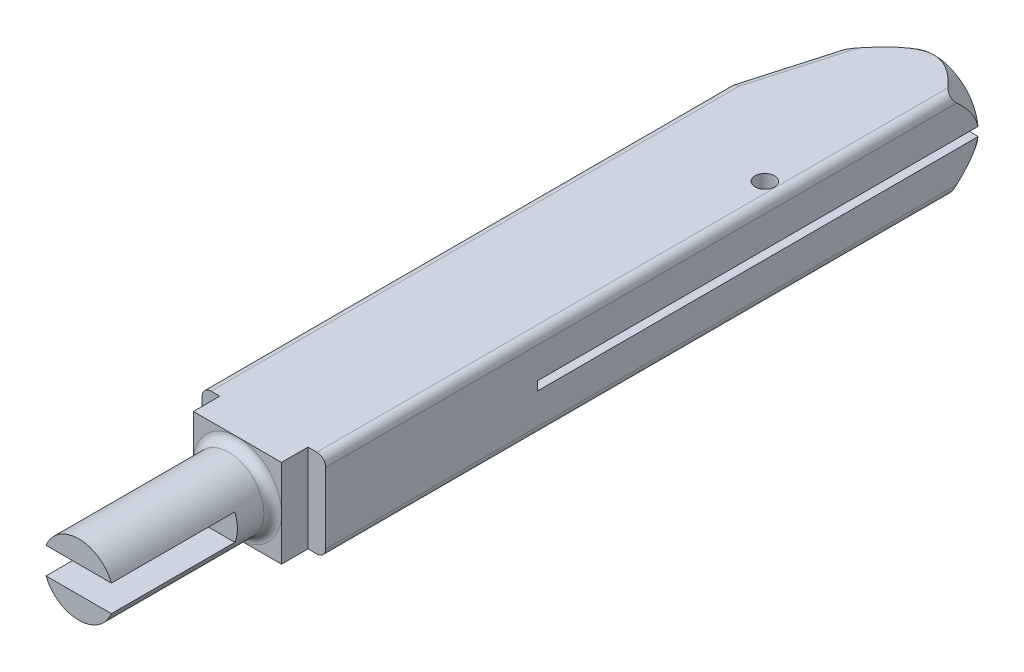
from build123d import *

# Parameters (mm, degrees)
SKETCH_1_W          = 7
SKETCH_1_H          = 5
EXTRUDE_1_DEPTH     = 37
SKETCH_2_W          = 5
SKETCH_2_H          = 5
EXTRUDE_2_DEPTH     = 1.5
SKETCH_3_R          = 2
EXTRUDE_3_DEPTH     = 9
SKETCH_4_W          = 14.679104028
SKETCH_4_H          = 1.5
CUT_EXTRUDE_1_DEPTH = 7
CUT_EXTRUDE_2_DEPTH = 48.890500102
SKETCH_6_W          = 13.59673758
SKETCH_6_H          = 0.5
CUT_EXTRUDE_3_DEPTH = 25
SKETCH_7_OUTSIDE_W  = 24.428
SKETCH_7_OUTSIDE_H  = 22.428
SKETCH_7_OUTSIDE_R  = 2.5
CUT_EXTRUDE_7_DEPTH = 5
CUT_EXTRUDE_7_DRAFT = -30
SKETCH_8_R          = 1
CUT_EXTRUDE_8_DEPTH = 15
FILLET_1_R          = 0.5
FILLET_2_R          = 0.5
SKETCH_9_R          = 0.55
CUT_EXTRUDE_9_DEPTH = 48.89050012
CHAMFER_1_SIZE      = 0.5


# Some blends are built 0.0001 mm under size
with BuildPart() as part:
    # 草图1 → 凸台-拉伸1 (new body)
    with BuildSketch(Plane.XY):
        Rectangle(SKETCH_1_W, SKETCH_1_H)
    extrude(amount=EXTRUDE_1_DEPTH)

    # 草图2 → 凸台-拉伸2 (add)
    with BuildSketch(Plane.XY.offset(37)):
        Rectangle(SKETCH_2_W, SKETCH_2_H)
    extrude(amount=EXTRUDE_2_DEPTH)

    # 草图3 → 凸台-拉伸3 (add)
    with BuildSketch(Plane.XY.offset(38.5)):
        Circle(SKETCH_3_R)
    extrude(amount=EXTRUDE_3_DEPTH)

    # 草图4 → 切除-拉伸1 (cut)
    with BuildSketch(Plane.XY.offset(47.5)):
        Rectangle(SKETCH_4_W, SKETCH_4_H)
    extrude(amount=-CUT_EXTRUDE_1_DEPTH, mode=Mode.SUBTRACT)

    # 草图5 → 切除-拉伸2 (cut, through all)
    with BuildSketch(Plane(origin=(0, 2.5, 0), x_dir=(1, 0, 0), z_dir=(0, 1, 0))):
        Polygon((-3.5, 0), (-3.5, -7), (-1.5, 0), align=None)
    extrude(amount=-CUT_EXTRUDE_2_DEPTH, mode=Mode.SUBTRACT)

    # 草图6 → 切除-拉伸3 (cut)
    with BuildSketch(Plane(origin=(0, 0, 0), x_dir=(-1, 0, 0), z_dir=(0, 0, -1))):
        Rectangle(SKETCH_6_W, SKETCH_6_H)
    extrude(amount=-CUT_EXTRUDE_3_DEPTH, mode=Mode.SUBTRACT)


with BuildPart() as cut_extrude_7_tool:
    # 草图7 outside → 切除-拉伸7 (with draft: the straight prism first)
    with BuildSketch(Plane(origin=(0, 0, 0), x_dir=(-1, 0, 0), z_dir=(0, 0, -1))):
        Rectangle(SKETCH_7_OUTSIDE_W, SKETCH_7_OUTSIDE_H)
        with Locations((-1, 0)):
            Circle(SKETCH_7_OUTSIDE_R, mode=Mode.SUBTRACT)
    extrude(amount=-CUT_EXTRUDE_7_DEPTH)
    # 切除-拉伸7: the draft: its side faces are tilted about the plane it starts from
    cut_extrude_7_sides = [cut_extrude_7_tool.faces().sort_by_distance(p)[0] for p in [
        (0, -11.214, 2.5),
        (-12.214, 0, 2.5),
        (0, 11.214, 2.5),
        (12.214, 0, 2.5),
        (3.5, 0, 2.5),
    ]]
    draft(cut_extrude_7_sides, Plane(origin=(0, 0, 0), x_dir=(-1, 0, 0), z_dir=(0, 0, -1)), CUT_EXTRUDE_7_DRAFT)


with BuildPart() as part_1:
    add(part.part)

    # 切除-拉伸7: cut by cut_extrude_7_tool
    add(cut_extrude_7_tool.part, mode=Mode.SUBTRACT)

    # 草图8 → 切除-拉伸8 (cut)
    with BuildSketch(Plane(origin=(0, 0, 0), x_dir=(-1, 0, 0), z_dir=(0, 0, -1))):
        with Locations((-1, 0)):
            Circle(SKETCH_8_R)
    extrude(amount=-CUT_EXTRUDE_8_DEPTH, mode=Mode.SUBTRACT)

    # 圆角1
    fillet_1_edges = [part_1.edges().sort_by_distance(p)[0] for p in [
        (-2.909595892, -2.5, 4.933585623),
        (-2.909595892, 2.5, 4.933585623),
        (3.5, -2.5, 19.396798669),
        (3.5, 2.5, 19.396798669),
        (-3.5, -2.5, 22),
        (-3.5, 2.5, 22),
    ]]
    fillet(fillet_1_edges, radius=FILLET_1_R)

    # 圆角2
    fillet_2_edges = [part_1.edges().sort_by_distance(p)[0] for p in [
        (-2, 0, 38.5),
    ]]
    fillet(fillet_2_edges, radius=FILLET_2_R - 0.0001)  # a hair under: the kernel refuses the full size

    # 草图9 → 切除-拉伸9 (cut, through all)
    with BuildSketch(Plane(origin=(0, 2.5, 0), x_dir=(1, 0, 0), z_dir=(0, 1, 0))):
        with Locations(Location((2.4, -11, 0), (0, 0, 270))):
            Circle(SKETCH_9_R)
    extrude(amount=-CUT_EXTRUDE_9_DEPTH, mode=Mode.SUBTRACT)

    # 倒角1
    # the kernel refuses this chamfer: 0.5 mm, written as the material it takes off along each edge
    with BuildSketch(Plane(origin=(2.4, -2.5, 11), x_dir=(0, 0, 1), z_dir=(-1, 0, 0))) as chamfer_1_piece_1:
        Polygon((0.55 + CHAMFER_1_SIZE, 0), (0.55, CHAMFER_1_SIZE), (0.55, 0), align=None)
    revolve(axis=Axis((2.4, -2.5, 11), (0, 1, 0)), mode=Mode.SUBTRACT)


solid = part_1.part
